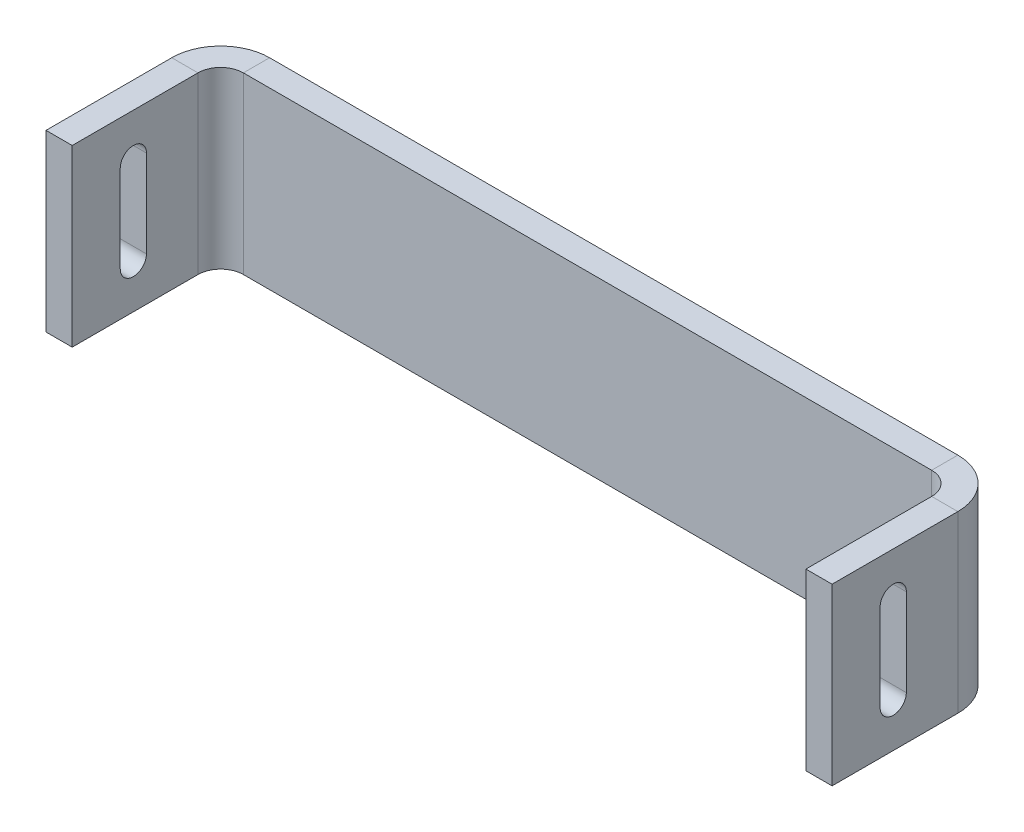
from build123d import *

# Parameters (mm, degrees)
SKETCH1_W                      = 90
SKETCH1_H                      = 20
BASE_FLANGE1_DEPTH             = 3
EDGE_FLANGE1_STRIP_W           = 17.2
EDGE_FLANGE1_STRIP_H           = 3
EDGE_FLANGE1_STRIP_CUT_DEPTH   = 20
EDGE_FLANGE1_STRIP_2_W         = 17.2
EDGE_FLANGE1_STRIP_2_H         = 3
EDGE_FLANGE1_STRIP_CUT_2_DEPTH = 20
EDGE_FLANGE1_DEPTH             = 20
EDGE_FLANGE1_BEND_DEPTH        = 20
CUT_EXTRUDE1_DEPTH             = 10
CUT_EXTRUDE2_START             = -10
CUT_EXTRUDE2_DEPTH             = 10


# Sheet-metal steps are written as plain solids
with BuildPart() as part:
    # Sketch1 → Base-Flange1 (new body)
    with BuildSketch(Plane.XY):
        Rectangle(SKETCH1_W, SKETCH1_H)
    extrude(amount=-BASE_FLANGE1_DEPTH)

    # Edge-Flange1 strip (across the edge) → Edge-Flange1 strip cut (cut)
    with BuildSketch(Plane(origin=(45, -10, 0), x_dir=(-1, 0, 0), z_dir=(0, 1, 0))):
        with Locations((-3, -1.5)):
            Rectangle(EDGE_FLANGE1_STRIP_W, EDGE_FLANGE1_STRIP_H)
    extrude(amount=EDGE_FLANGE1_STRIP_CUT_DEPTH, mode=Mode.SUBTRACT)

    # Edge-Flange1 strip 2 (across the edge) → Edge-Flange1 strip cut 2 (cut)
    with BuildSketch(Plane(origin=(-45, 10, 0), x_dir=(1, 0, 0), z_dir=(0, -1, 0))):
        with Locations((-3, -1.5)):
            Rectangle(EDGE_FLANGE1_STRIP_2_W, EDGE_FLANGE1_STRIP_2_H)
    extrude(amount=EDGE_FLANGE1_STRIP_CUT_2_DEPTH, mode=Mode.SUBTRACT)

    # Edge-Flange1 section (across the edge) → Edge-Flange1 (add)
    with BuildSketch(Plane(origin=(45, -10, 0), x_dir=(-1, 0, 0), z_dir=(0, 1, 0))):
        with BuildLine():
            Line((0, 2.6), (0, 17))
            Line((0, 17), (3, 17))
            Line((3, 17), (3, 2.6))
            ThreePointArc((3, 2.6), (3.761522369, 0.761522369), (5.6, 0))
            Line((5.6, 0), (5.6, -3))
            ThreePointArc((5.6, -3), (1.640202025, -1.359797975), (0, 2.6))
        make_face()
    extrude(amount=EDGE_FLANGE1_DEPTH)

    # Edge-Flange1 section 2 (across the edge) → Edge-Flange1 bend (add)
    with BuildSketch(Plane(origin=(-45, 10, 0), x_dir=(1, 0, 0), z_dir=(0, -1, 0))):
        with BuildLine():
            Line((0, 2.6), (0, 17))
            Line((0, 17), (3, 17))
            Line((3, 17), (3, 2.6))
            ThreePointArc((3, 2.6), (3.761522369, 0.761522369), (5.6, 0))
            Line((5.6, 0), (5.6, -3))
            ThreePointArc((5.6, -3), (1.640202025, -1.359797975), (0, 2.6))
        make_face()
    extrude(amount=EDGE_FLANGE1_BEND_DEPTH)

    # Sketch12 → Cut-Extrude1 (cut)
    with BuildSketch(Plane.ZY.offset(45)):
        with BuildLine():
            Line((11.5, 5), (11.5, -5))
            ThreePointArc((11.5, -5), (10, -6.5), (8.5, -5))
            Line((8.5, -5), (8.5, 5))
            ThreePointArc((8.5, 5), (10, 6.5), (11.5, 5))
        make_face()
    extrude(amount=-CUT_EXTRUDE1_DEPTH, mode=Mode.SUBTRACT)

    # Sketch13 → Cut-Extrude2 (cut)
    with BuildSketch(Plane(origin=(45, 0, 0), x_dir=(0, 0, -1), z_dir=(1, 0, 0)).offset(CUT_EXTRUDE2_START)):
        with BuildLine():
            Line((-8.5, 5), (-8.5, -5))
            ThreePointArc((-8.5, -5), (-10, -6.5), (-11.5, -5))
            Line((-11.5, -5), (-11.5, 5))
            ThreePointArc((-11.5, 5), (-10, 6.5), (-8.5, 5))
        make_face()
    extrude(amount=CUT_EXTRUDE2_DEPTH, mode=Mode.SUBTRACT)


solid = part.part
